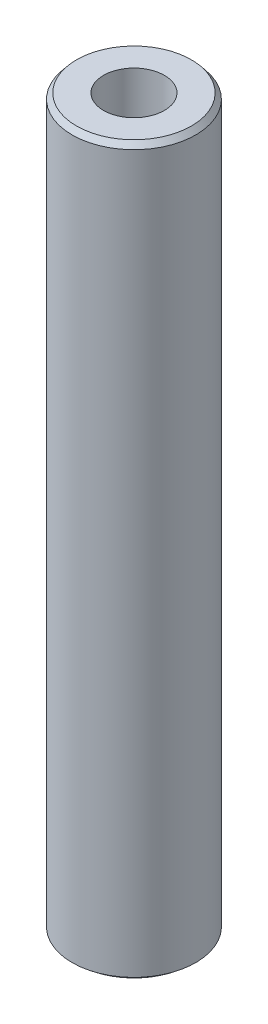
from build123d import *
from OCP.BRepFilletAPI import BRepFilletAPI_MakeChamfer

# Parameters (mm, degrees)
SKETCH1_R           = 15
BOSS_EXTRUDE1_DEPTH = 176.241932532
SKETCH2_R           = 7.383069666
CUT_EXTRUDE1_DEPTH  = 178.513996019
CHAMFER1_SIZE       = 1.330295849
CHAMFER1_SIZE2      = 1.071900147


with BuildPart() as part:
    # Sketch1 → Boss-Extrude1 (new body)
    with BuildSketch(Plane(origin=(0, 0, 0), x_dir=(1, 0, 0), z_dir=(0, 1, 0))):
        Circle(SKETCH1_R)
    extrude(amount=BOSS_EXTRUDE1_DEPTH)

    # Sketch2 → Cut-Extrude1 (cut, through all)
    with BuildSketch(Plane(origin=(0, 0, 0), x_dir=(1, 0, 0), z_dir=(0, 1, 0))):
        Circle(SKETCH2_R)
    extrude(amount=CUT_EXTRUDE1_DEPTH, mode=Mode.SUBTRACT)

    # Chamfer1: one chamfer whose edges measure the first distance from different faces: ONE call of the kernel's chamfer builder (chamfer() names one face for all edges)
    chamfer1_edges_1 = [part.edges().sort_by_distance(p)[0] for p in [
        (-15, 176.241932532, 0),
    ]]
    chamfer1_side_1 = [part.faces().sort_by_distance(p)[0] for p in [
        (-15, 88.120966266, 0),
    ]]
    chamfer1_edges_2 = [part.edges().sort_by_distance(p)[0] for p in [
        (-15, 0, 0),
    ]]
    chamfer1_side_2 = [part.faces().sort_by_distance(p)[0] for p in [
        (-14.575735931, 0, 0),
    ]]
    chamfer1 = BRepFilletAPI_MakeChamfer(part.part.solid().wrapped)
    for e in chamfer1_edges_1:
        chamfer1.Add(CHAMFER1_SIZE, CHAMFER1_SIZE2, e.wrapped, chamfer1_side_1[0].wrapped)  # the first distance lies on this face
    for e in chamfer1_edges_2:
        chamfer1.Add(CHAMFER1_SIZE, CHAMFER1_SIZE2, e.wrapped, chamfer1_side_2[0].wrapped)  # the first distance lies on this face
    add(Compound.cast(chamfer1.Shape()), mode=Mode.REPLACE)


solid = part.part
